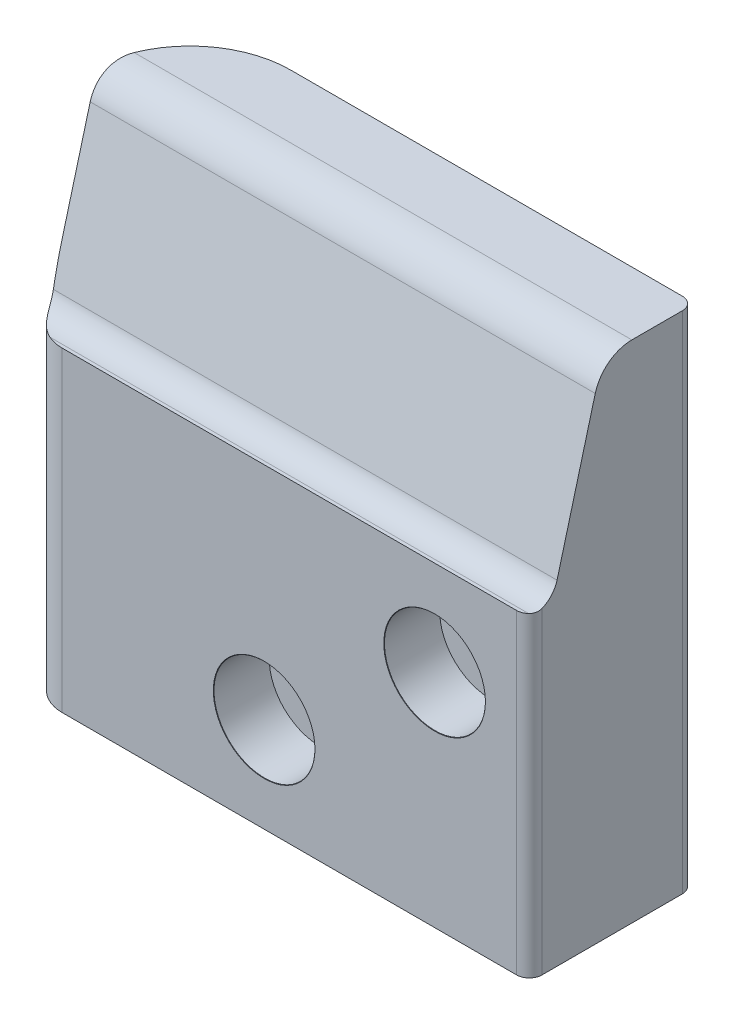
from build123d import *

# Parameters (mm, degrees)
BOSS_EXTRUDE1_DEPTH                          = 20
FILLET1_R                                    = 1
FILLET2_R                                    = 2
FILLET3_R                                    = 8
FILLET4_R                                    = 3
CBORE_FOR_M4_HEX_SOCKET_HEAD_CAP_SCR_2_COUNT = 2
CBORE_FOR_M4_HEX_SOCKET_HEAD_CAP_SCR_2_PITCH = 16.800297616


with BuildPart() as part:
    # Sketch1 → Boss-Extrude1 (new, symmetric)
    with BuildSketch(Plane(origin=(0, 0, 0), x_dir=(0, 0, -1), z_dir=(1, 0, 0))):
        with BuildLine():
            Line((-5, 0), (0, 0))
            Line((0, 0), (0, -40))
            Line((0, -40), (-13.12, -40))
            Line((-13.12, -40), (-13.12, -15))
            Line((-13.12, -15), (-11.32121885, -15))
            Line((-11.32121885, -15), (-7.897777479, -2.223542865))
            ThreePointArc((-7.897777479, -2.223542865), (-6.826284287, -0.619939979), (-5, 0))
        make_face()
    extrude(amount=BOSS_EXTRUDE1_DEPTH, both=True)

    # Fillet1
    fillet1_edges = [part.edges().sort_by_distance(p)[0] for p in [
        (20, -20, 0),
        (20, -27.5, 13.12),
    ]]
    fillet(fillet1_edges, radius=FILLET1_R)

    # Fillet2
    fillet2_edges = [part.edges().sort_by_distance(p)[0] for p in [
        (0, -15, 11.32121885),
    ]]
    fillet(fillet2_edges, radius=FILLET2_R)

    # Fillet3
    fillet3_edges = [part.edges().sort_by_distance(p)[0] for p in [
        (-20, -20, 0),
    ]]
    fillet(fillet3_edges, radius=FILLET3_R)

    # Fillet4
    fillet4_edges = [part.edges().sort_by_distance(p)[0] for p in [
        (-20, -27.5, 13.12),
    ]]
    fillet(fillet4_edges, radius=FILLET4_R)

    # Sketch7 → CBORE for M4 Hex Socket Head Cap Screw1 (revolve, cut)
    with BuildSketch(Plane(origin=(12.5, -22.5, 13.12), x_dir=(0, -1, 0), z_dir=(1, 0, 0))):
        Polygon((0, 0), (0, 13.12), (2.15, 13.12), (2.15, 4.4), (4, 4.4), (4, 0.025), (4.025, 0), align=None)
    cbore_for_m4_hex_socket_head_cap_screw1 = revolve(axis=Axis((12.5, -22.5, 19.47), (0, 0, -1)), mode=Mode.SUBTRACT)

    # CBORE for M4 Hex Socket Head Cap Scr 2: CBORE for M4 Hex Socket Head Cap Screw1 ×2
    with Locations(*[Vector(-0.8035571933447457, -0.5952275506257376, 0) * (i * CBORE_FOR_M4_HEX_SOCKET_HEAD_CAP_SCR_2_PITCH) for i in range(1, CBORE_FOR_M4_HEX_SOCKET_HEAD_CAP_SCR_2_COUNT)]):
        add(cbore_for_m4_hex_socket_head_cap_screw1, mode=Mode.SUBTRACT)


solid = part.part
